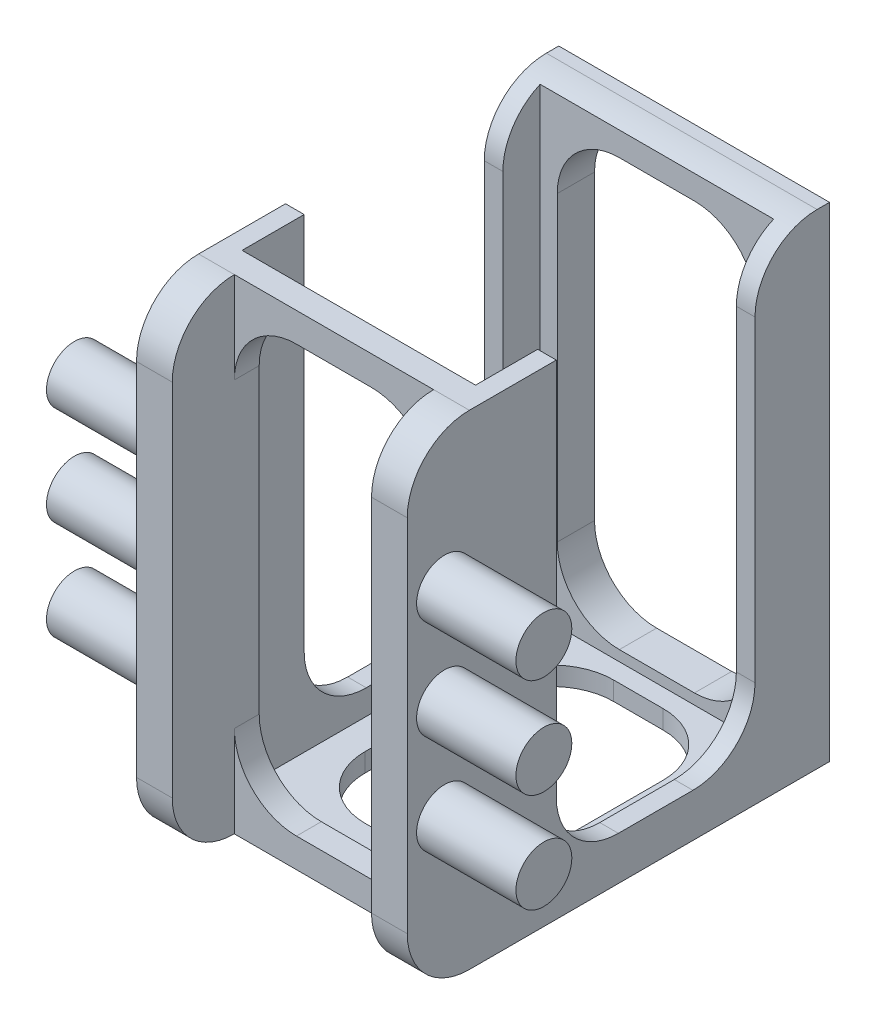
from build123d import *

# Parameters (mm, degrees)
SKETCH1_W               = 21.8
SKETCH1_H               = 39
BOSS_EXTRUDE1_DEPTH     = 3
BOSS_EXTRUDE2_DEPTH     = 3
BOSS_EXTRUDE4_DEPTH     = 21
SKETCH4_W               = 21.8
SKETCH4_H               = 39
BOSS_EXTRUDE5_DEPTH     = 2
CUT_EXTRUDE1_DEPTH      = 50.807730324
CUT_EXTRUDE1_DEPTH_BACK = 50.807730324
SKETCH5_W               = 14
SKETCH5_H               = 20
BOSS_EXTRUDE6_DEPTH     = 5
SKETCH7_W               = 14.6
SKETCH7_H               = 1.5
CUT_EXTRUDE2_DEPTH      = 2
SKETCH8_W               = 16.04420395
SKETCH8_H               = 34.30198165
CUT_EXTRUDE3_DEPTH      = 35.279148181
SKETCH9_W               = 16.04420395
SKETCH9_H               = 34.30198165
CUT_EXTRUDE4_DEPTH      = 2
SKETCH10_W              = 2.1
SKETCH10_H              = 1.5
CUT_EXTRUDE5_DEPTH      = 2
SKETCH11_W              = 2.1
SKETCH11_H              = 1.5
CUT_EXTRUDE6_DEPTH      = 2
SKETCH13_W              = 18.8
SKETCH13_H              = 1.5
CUT_EXTRUDE7_DEPTH      = 3
FILLET3_R               = 5
FILLET4_R               = 5
SKETCH17_W              = 1.5
SKETCH17_H              = 16
BOSS_EXTRUDE8_DEPTH     = 2
FILLET5_R               = 5
BOSS_EXTRUDE9_DEPTH     = 5
SKETCH24_R              = 2.25
BOSS_EXTRUDE10_DEPTH    = 8
BOSS_EXTRUDE11_START    = 8
SKETCH25_R              = 2.25
BOSS_EXTRUDE11_DEPTH    = 8
FILLET7_R               = 5


with BuildPart() as part:
    # Sketch1 → Boss-Extrude1 (new body)
    with BuildSketch(Plane.XY):
        Rectangle(SKETCH1_W, SKETCH1_H)
    extrude(amount=BOSS_EXTRUDE1_DEPTH)

    # Sketch2 → Boss-Extrude2 (add)
    with BuildSketch(Plane.XY.offset(3)):
        Polygon((-10.9, 19.5), (-9.4, 19.5), (-9.4, -18), (9.4, -18), (9.4, 19.5), (10.9, 19.5), (10.9, -19.5), (-10.9, -19.5), align=None)
    extrude(amount=BOSS_EXTRUDE2_DEPTH)

    # Sketch3 → Boss-Extrude4 (add)
    with BuildSketch(Plane.XY.offset(6)):
        Polygon((-9.4, -18), (-10.9, -18), (-10.9, -19.5), (10.9, -19.5), (10.9, -18), align=None)
    extrude(amount=BOSS_EXTRUDE4_DEPTH)

    # Sketch4 → Boss-Extrude5 (add)
    with BuildSketch(Plane.XY.offset(27)):
        Rectangle(SKETCH4_W, SKETCH4_H)
    extrude(amount=BOSS_EXTRUDE5_DEPTH)

    # Sketch5 → Cut-Extrude1 (cut, two sides: drawn at the far end of the back side and taken through both)
    with BuildSketch(Plane.XZ.offset(19.5).offset(-CUT_EXTRUDE1_DEPTH_BACK)):
        with Locations((0, 14.5)):
            Rectangle(SKETCH5_W, SKETCH5_H)
    extrude(amount=CUT_EXTRUDE1_DEPTH + CUT_EXTRUDE1_DEPTH_BACK, mode=Mode.SUBTRACT)

    # Sketch6 → Boss-Extrude6 (add)
    with BuildSketch(Plane(origin=(0, 0, 27), x_dir=(-1, 0, 0), z_dir=(0, 0, -1))):
        Polygon((-9.4, -18), (-9.4, 18), (9.4, 18), (9.4, -18), (10.9, -18), (10.9, 19.5), (-10.9, 19.5), (-10.9, -18), align=None)
    extrude(amount=BOSS_EXTRUDE6_DEPTH)

    # Sketch7 → Cut-Extrude2 (cut)
    with BuildSketch(Plane(origin=(0, 0, 22), x_dir=(-1, 0, 0), z_dir=(0, 0, -1))):
        with Locations((0, 18.75)):
            Rectangle(SKETCH7_W, SKETCH7_H)
    extrude(amount=-CUT_EXTRUDE2_DEPTH, mode=Mode.SUBTRACT)

    # Sketch8 → Cut-Extrude3 (cut, through all)
    with BuildSketch(Plane.XY.offset(3)):
        Rectangle(SKETCH8_W, SKETCH8_H)
    extrude(amount=-CUT_EXTRUDE3_DEPTH, mode=Mode.SUBTRACT)

    # Sketch9 → Cut-Extrude4 (cut)
    with BuildSketch(Plane(origin=(0, 0, 27), x_dir=(-1, 0, 0), z_dir=(0, 0, -1))):
        Rectangle(SKETCH9_W, SKETCH9_H)
    extrude(amount=-CUT_EXTRUDE4_DEPTH, mode=Mode.SUBTRACT)

    # Sketch10 → Cut-Extrude5 (cut)
    with BuildSketch(Plane(origin=(0, 0, 22), x_dir=(-1, 0, 0), z_dir=(0, 0, -1))):
        with Locations((8.35, 18.75)):
            Rectangle(SKETCH10_W, SKETCH10_H)
    extrude(amount=-CUT_EXTRUDE5_DEPTH, mode=Mode.SUBTRACT)

    # Sketch11 → Cut-Extrude6 (cut)
    with BuildSketch(Plane(origin=(0, 0, 22), x_dir=(-1, 0, 0), z_dir=(0, 0, -1))):
        with Locations((-8.35, 18.75)):
            Rectangle(SKETCH11_W, SKETCH11_H)
    extrude(amount=-CUT_EXTRUDE6_DEPTH, mode=Mode.SUBTRACT)

    # Sketch13 → Cut-Extrude7 (cut)
    with BuildSketch(Plane(origin=(0, 0, 24), x_dir=(-1, 0, 0), z_dir=(0, 0, -1))):
        with Locations((0, 18.75)):
            Rectangle(SKETCH13_W, SKETCH13_H)
    extrude(amount=-CUT_EXTRUDE7_DEPTH, mode=Mode.SUBTRACT)

    # Fillet3
    fillet3_edges = [part.edges().sort_by_distance(p)[0] for p in [
        (8.022101975, 17.150990825, 1.5),
        (8.022101975, -17.150990825, 1.5),
        (-8.022101975, -17.150990825, 1.5),
        (-8.022101975, 17.150990825, 1.5),
        (-8.022101975, -17.150990825, 28),
        (8.022101975, -17.150990825, 28),
    ]]
    fillet(fillet3_edges, radius=FILLET3_R)

    # Fillet4
    fillet4_edges = [part.edges().sort_by_distance(p)[0] for p in [
        (-8.022101975, 17.150990825, 28),
        (8.022101975, 17.150990825, 28),
    ]]
    fillet(fillet4_edges, radius=FILLET4_R)

    # Sketch17 → Boss-Extrude8 (add)
    with BuildSketch(Plane(origin=(0, -18, 0), x_dir=(1, 0, 0), z_dir=(0, 1, 0))):
        with Locations((-10.15, -14)):
            Rectangle(SKETCH17_W, SKETCH17_H)
        with Locations((10.15, -14)):
            Rectangle(SKETCH17_W, SKETCH17_H)
    extrude(amount=BOSS_EXTRUDE8_DEPTH)

    # Fillet5
    fillet5_edges = [part.edges().sort_by_distance(p)[0] for p in [
        (-10.15, -16, 22),
        (-10.15, -16, 6),
        (10.15, -16, 6),
        (10.15, -16, 22),
        (7, -18.75, 24.5),
        (7, -18.75, 4.5),
        (-7, -18.75, 4.5),
        (-7, -18.75, 24.5),
    ]]
    fillet(fillet5_edges, radius=FILLET5_R)

    # Sketch19 → Boss-Extrude9 (add)
    with BuildSketch(Plane.XY.offset(29)):
        Polygon((-10.9, 19.5), (-10.9, -19.5), (-8.022101975, -19.5), (-8.022101975, -12.150990825), (-8.022101975, 12.150990825), (-8.022101975, 19.5), align=None)
        Polygon((8.022101975, 12.150990825), (8.022101975, 19.5), (10.9, 19.5), (10.9, -19.5), (8.022101975, -19.5), align=None)
    extrude(amount=BOSS_EXTRUDE9_DEPTH)

    # Sketch24 → Boss-Extrude10 (add)
    with BuildSketch(Plane.ZY.offset(10.9)):
        with Locations(Location((31, 8.15, 0), (0, 0, 180))):
            Circle(SKETCH24_R)
        with Locations(Location((31, 0.15, 0), (0, 0, 180))):
            Circle(SKETCH24_R)
        with Locations(Location((31, -7.85, 0), (0, 0, 180))):
            Circle(SKETCH24_R)
    extrude(amount=BOSS_EXTRUDE10_DEPTH)

    # Sketch25 → Boss-Extrude11 (add)
    with BuildSketch(Plane(origin=(10.9, 0, 0), x_dir=(0, 0, -1), z_dir=(1, 0, 0)).offset(BOSS_EXTRUDE11_START)):
        with Locations((-31, 8.15)):
            Circle(SKETCH25_R)
        with Locations((-31, 0.15)):
            Circle(SKETCH25_R)
        with Locations((-31, -7.85)):
            Circle(SKETCH25_R)
    extrude(amount=-BOSS_EXTRUDE11_DEPTH)

    # Fillet7
    fillet7_edges = [part.edges().sort_by_distance(p)[0] for p in [
        (-9.461050988, -19.5, 34),
        (9.461050988, -19.5, 34),
        (-10.15, 19.5, 6),
        (9.461050988, 19.5, 34),
        (-9.461050988, 19.5, 34),
    ]]
    fillet(fillet7_edges, radius=FILLET7_R - 0.0001)  # a hair under: the kernel refuses the full size


solid = part.part
